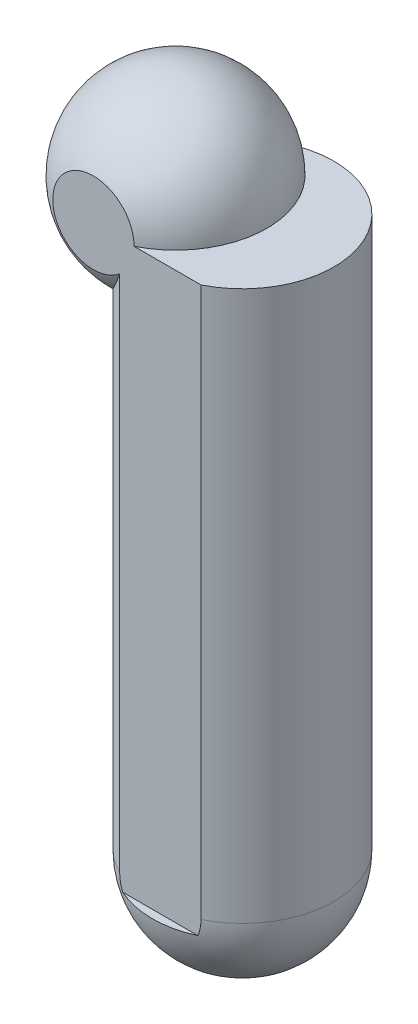
from build123d import *

# Parameters (mm, degrees)
SKETCH1_R               = 50
BOSS_EXTRUDE1_DEPTH     = 300
CUT_EXTRUDE1_DEPTH      = 364.987490242
CUT_EXTRUDE1_DEPTH_BACK = 364.987490242
SKETCH4_W               = 12.597132099
SKETCH4_H               = 279.427293847
CUT_EXTRUDE2_DEPTH      = 364.987490242
CUT_EXTRUDE2_DEPTH_BACK = 364.987490242
SKETCH5_W               = 13.949781053
SKETCH5_H               = 363.760783887


with BuildPart() as part:
    # Sketch1 → Boss-Extrude1 (new body)
    with BuildSketch(Plane(origin=(0, 0, 0), x_dir=(1, 0, 0), z_dir=(0, 1, 0))):
        Circle(SKETCH1_R)
    extrude(amount=BOSS_EXTRUDE1_DEPTH)

    # Sketch2 → Revolve1 (revolve)
    with BuildSketch(Plane.XY):
        with BuildLine():
            Line((-36.526834234, 250), (-36.526834234, 350))
            ThreePointArc((-36.526834234, 350), (13.473165766, 300), (-36.526834234, 250))
        make_face()
    revolve(axis=Axis((-36.526834234, 250, 0), (0, 1, 0)))

    # Sketch3 → Revolve2 (revolve)
    with BuildSketch(Plane.XY):
        with BuildLine():
            Line((0, -50), (0, 50))
            ThreePointArc((0, 50), (50, 0), (0, -50))
        make_face()
    revolve(axis=Axis((0, -50, 0), (0, 1, 0)))

    # Sketch4 → Cut-Extrude1 (cut, two sides: drawn at the far end of the back side and taken through both)
    with BuildSketch(Plane.XY.offset(-CUT_EXTRUDE1_DEPTH_BACK)):
        with Locations((-53.478127305, 108.200425306)):
            Rectangle(SKETCH4_W, SKETCH4_H)
    extrude(amount=CUT_EXTRUDE1_DEPTH + CUT_EXTRUDE1_DEPTH_BACK, mode=Mode.SUBTRACT)

    # Sketch5 → Cut-Extrude2 (cut, two sides: drawn at the far end of the back side and taken through both)
    with BuildSketch(Plane(origin=(0, 0, 0), x_dir=(0, 0, -1), z_dir=(1, 0, 0)).offset(-CUT_EXTRUDE2_DEPTH_BACK)):
        with Locations((-51.783725954, 173.445822779)):
            Rectangle(SKETCH5_W, SKETCH5_H)
    extrude(amount=CUT_EXTRUDE2_DEPTH + CUT_EXTRUDE2_DEPTH_BACK, mode=Mode.SUBTRACT)


solid = part.part
